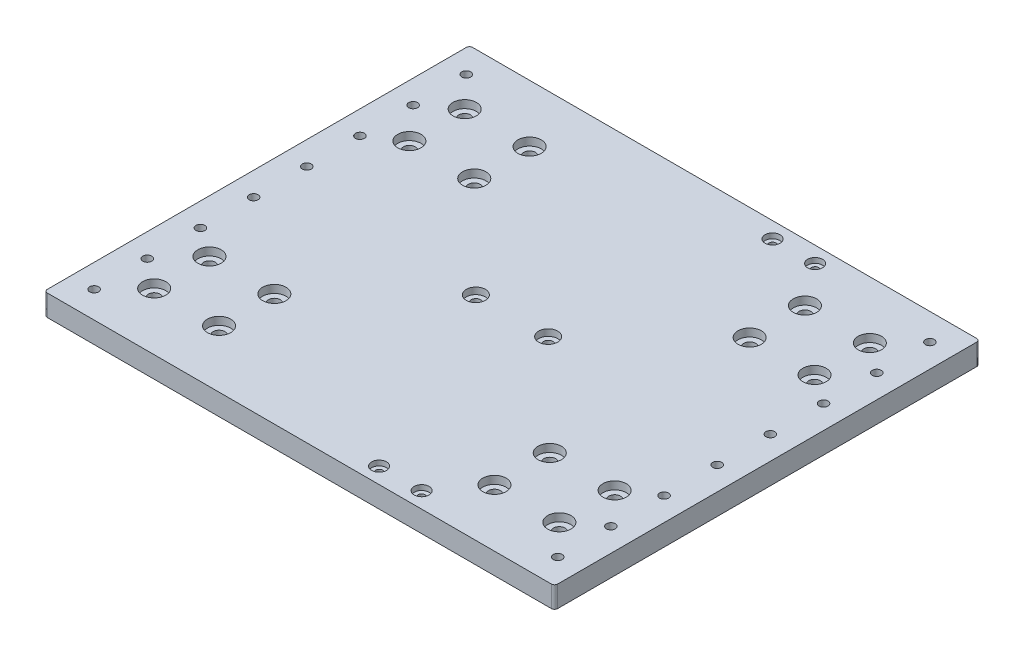
from build123d import *

# Parameters (mm, degrees)
SKETCH1_W                                        = 240
SKETCH1_H                                        = 200
BOSS_EXTRUDE1_DEPTH                              = 5
CBORE_FOR_M5_PAN_HEAD_MACHINE_SCREW1_D           = 5.5
CBORE_FOR_M5_PAN_HEAD_MACHINE_SCREW1_CBORE_D     = 11
CBORE_FOR_M5_PAN_HEAD_MACHINE_SCREW1_CBORE_DEPTH = 3.7
MIRROR2_COPY_1_D                                 = 5.5
MIRROR2_COPY_1_CBORE_D                           = 11
MIRROR2_COPY_1_CBORE_DEPTH                       = 3.7
MIRROR2_COPY_2_D                                 = 5.5
MIRROR2_COPY_2_CBORE_D                           = 11
MIRROR2_COPY_2_CBORE_DEPTH                       = 3.7
CBORE_FOR_M4_PAN_HEAD_MACHINE_SCREW1_D           = 4.5
CBORE_FOR_M4_PAN_HEAD_MACHINE_SCREW1_CBORE_D     = 9
CBORE_FOR_M4_PAN_HEAD_MACHINE_SCREW1_CBORE_DEPTH = 3.1
M5X0_8_TAPPED_HOLE1_D                            = 4.2
FILLET1_R                                        = 1.5
LPATTERN2_COUNT                                  = 8
LPATTERN2_PITCH                                  = 25
CBORE_FOR_M3_PAN_HEAD_MACHINE_SCREW1_D           = 3.2
CBORE_FOR_M3_PAN_HEAD_MACHINE_SCREW1_CBORE_D     = 7
CBORE_FOR_M3_PAN_HEAD_MACHINE_SCREW1_CBORE_DEPTH = 2.4


with BuildPart() as part:
    # Sketch1 → Boss-Extrude1 (new, symmetric)
    with BuildSketch(Plane(origin=(0, 0, 0), x_dir=(1, 0, 0), z_dir=(0, 1, 0))):
        Rectangle(SKETCH1_W, SKETCH1_H)
    extrude(amount=BOSS_EXTRUDE1_DEPTH, both=True)

    # CBORE for M5 Pan Head Machine Screw1 (through all)
    with Locations(Plane(origin=(66.92305649, 5, -81.969265096), x_dir=(-1, 0, 0), z_dir=(0, 1, 0))):
        with Locations((162.17305649, 154.969265096), (131.67305649, 154.969265096), (131.67305649, 128.969265096), (162.17305649, 128.969265096)):
            cbore_for_m5_pan_head_machine_screw1 = CounterBoreHole(CBORE_FOR_M5_PAN_HEAD_MACHINE_SCREW1_D / 2, CBORE_FOR_M5_PAN_HEAD_MACHINE_SCREW1_CBORE_D / 2, CBORE_FOR_M5_PAN_HEAD_MACHINE_SCREW1_CBORE_DEPTH)

    # Mirror1: CBORE for M5 Pan Head Machine Screw1 across plane
    add(cbore_for_m5_pan_head_machine_screw1.mirror(Plane(origin=(0, 0, 0), x_dir=(0, 0, 1), z_dir=(1, 0, 0))), mode=Mode.SUBTRACT)

    # Mirror2 copy 1 (through all)
    with Locations(Plane(origin=(-66.92305649, 5, 81.969265096), x_dir=(1, 0, 0), z_dir=(0, 1, 0))):
        with Locations((162.17305649, 154.969265096), (131.67305649, 154.969265096), (131.67305649, 128.969265096), (162.17305649, 128.969265096)):
            CounterBoreHole(MIRROR2_COPY_1_D / 2, MIRROR2_COPY_1_CBORE_D / 2, MIRROR2_COPY_1_CBORE_DEPTH)

    # Mirror2 copy 2 (through all)
    with Locations(Plane(origin=(66.92305649, 5, 81.969265096), x_dir=(-1, 0, 0), z_dir=(0, 1, 0))):
        with Locations((162.17305649, -154.969265096), (131.67305649, -154.969265096), (131.67305649, -128.969265096), (162.17305649, -128.969265096)):
            CounterBoreHole(MIRROR2_COPY_2_D / 2, MIRROR2_COPY_2_CBORE_D / 2, MIRROR2_COPY_2_CBORE_DEPTH)

    # CBORE for M4 Pan Head Machine Screw1 (through all)
    with Locations(Plane(origin=(-30.338508942, 5, -23.538498317), x_dir=(-1, 0, 0), z_dir=(0, 1, 0))):
        with Locations((-13.338508942, 23.538498317), (-47.338508942, 23.538498317)):
            CounterBoreHole(CBORE_FOR_M4_PAN_HEAD_MACHINE_SCREW1_D / 2, CBORE_FOR_M4_PAN_HEAD_MACHINE_SCREW1_CBORE_D / 2, CBORE_FOR_M4_PAN_HEAD_MACHINE_SCREW1_CBORE_DEPTH)

    # M5x0.8 Tapped Hole1 (through all)
    with Locations(Plane(origin=(0, 5, 0), x_dir=(1, 0, 0), z_dir=(0, 1, 0))):
        with Locations((-109, 87.5), (109, 87.5)):
            m5x0_8_tapped_hole1 = Hole(M5X0_8_TAPPED_HOLE1_D / 2)

    # Fillet1
    fillet1_edges = [part.edges().sort_by_distance(p)[0] for p in [
        (-120, 0, -100),
        (120, 0, -100),
        (-120, 0, 100),
        (120, 0, 100),
    ]]
    fillet(fillet1_edges, radius=FILLET1_R)

    # LPattern2: M5x0.8 Tapped Hole1 ×8
    with Locations(*[(0, 0, i * LPATTERN2_PITCH) for i in range(1, LPATTERN2_COUNT)]):
        add(m5x0_8_tapped_hole1, mode=Mode.SUBTRACT)

    # CBORE for M3 Pan Head Machine Screw1 (through all)
    with Locations(Plane(origin=(0, 5, 0), x_dir=(1, 0, 0), z_dir=(0, 1, 0))):
        with Locations((30, 92.5), (50, 92.5)):
            cbore_for_m3_pan_head_machine_screw1 = CounterBoreHole(CBORE_FOR_M3_PAN_HEAD_MACHINE_SCREW1_D / 2, CBORE_FOR_M3_PAN_HEAD_MACHINE_SCREW1_CBORE_D / 2, CBORE_FOR_M3_PAN_HEAD_MACHINE_SCREW1_CBORE_DEPTH)

    # Mirror3: CBORE for M3 Pan Head Machine Screw1 across plane
    add(cbore_for_m3_pan_head_machine_screw1.mirror(Plane.XY), mode=Mode.SUBTRACT)


solid = part.part
